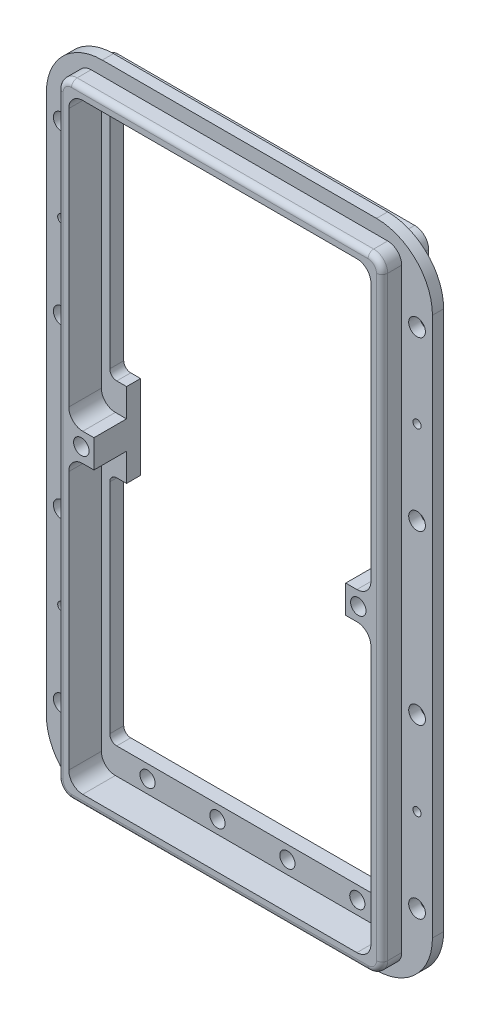
from build123d import *

# Parameters (mm, degrees)
SKETCH1_W             = 73.66
SKETCH1_H             = 141.478
PLATE_DEPTH           = 3.175
SKETCH2_W             = 73.66
SKETCH2_H             = 141.478
SKETCH2_W_2           = 68.58
SKETCH2_H_2           = 136.398
WALLS_DEPTH           = 10.576866729
LIP_W                 = 87.63
LIP_H                 = 147.828
LIP_W_2               = 73.66
LIP_H_2               = 141.478
FLANGE_DEPTH          = 2.54
FILLET1_R             = 12.7
FILLET2_R             = 3.175
FILLET3_R             = 1.27
SKETCH16_W            = 5.715
SKETCH16_H            = 6.35
EXTRUDE4_DEPTH        = 7.401866729
FILLET6_R             = 3.175
F_6_CLEARANCE_HOLE1_D = 3.7973
F_1_64_TAPPED_HOLE1_D = 1.8542
CUT_EXTRUDE7_DEPTH    = 87.573112055
FILLET7_R             = 1.5875
FILLET7_OF_MIRROR5_R  = 1.5875
MIRROR6_DEPTH         = 3.175
F_4_CLEAR_MID_D       = 3.4544
HOLE_PAT_COUNT        = 3
HOLE_PAT_PITCH        = 15.875
HOLE_PAT_COL_COUNT    = 2
HOLE_PAT_COL_PITCH    = 15.875
MIRROR7_COPY_1_D      = 3.4544
MIRROR7_COPY_2_D      = 3.4544
MIRROR7_COPY_3_D      = 3.4544
MIRROR7_COPY_4_D      = 3.4544


# Read off the part's stored shape, not the designer's step: Mirror6
with BuildPart() as part:
    # Sketch1 → plate (new body)
    with BuildSketch(Plane.XY):
        Rectangle(SKETCH1_W, SKETCH1_H)
    extrude(amount=PLATE_DEPTH)

    # Sketch2 → walls (add)
    with BuildSketch(Plane.XY):
        Rectangle(SKETCH2_W, SKETCH2_H)
        Rectangle(SKETCH2_W_2, SKETCH2_H_2, mode=Mode.SUBTRACT)
    extrude(amount=WALLS_DEPTH)

    # lip → flange (add)
    with BuildSketch(Plane(origin=(0, 0, 6.131866729), x_dir=(1, 0, 0), z_dir=(0, 0, -1))):
        Rectangle(LIP_W, LIP_H)
        Rectangle(LIP_W_2, LIP_H_2, mode=Mode.SUBTRACT)
    extrude(amount=FLANGE_DEPTH)

    # Fillet1
    fillet1_edges = [part.edges().sort_by_distance(p)[0] for p in [
        (-43.815, 73.914, 4.861866729),
        (43.815, 73.914, 4.861866729),
        (43.815, -73.914, 4.861866729),
        (-43.815, -73.914, 4.861866729),
    ]]
    fillet(fillet1_edges, radius=FILLET1_R)

    # Fillet2
    fillet2_edges = [part.edges().sort_by_distance(p)[0] for p in [
        (34.29, -68.199, 6.875933364),
        (34.29, 68.199, 6.875933364),
        (-34.29, 68.199, 6.875933364),
        (-34.29, -68.199, 6.875933364),
        (-36.83, -70.739, 1.795933365),
        (-36.83, 70.739, 1.795933365),
        (36.83, 70.739, 1.795933365),
        (36.83, -70.739, 1.795933365),
        (-36.83, -70.739, 8.354366729),
        (-36.83, 70.739, 8.354366729),
        (36.83, 70.739, 8.354366729),
        (36.83, -70.739, 8.354366729),
    ]]
    fillet(fillet2_edges, radius=FILLET2_R)

    # Fillet3
    fillet3_edges = [part.edges().sort_by_distance(p)[0] for p in [
        (0, 70.739, 10.576866729),
        (0, -70.739, 10.576866729),
        (36.83, 0, 10.576866729),
        (-35.90006403, -69.80906403, 10.576866729),
        (35.90006403, -69.80906403, 10.576866729),
        (35.90006403, 69.80906403, 10.576866729),
        (-35.90006403, 69.80906403, 10.576866729),
        (-36.83, 0, 10.576866729),
    ]]
    fillet(fillet3_edges, radius=FILLET3_R)

    # Sketch16 → Extrude4 (add)
    with BuildSketch(Plane.XY.offset(3.175)):
        with Locations((-31.4325, 0)):
            Rectangle(SKETCH16_W, SKETCH16_H)
    extrude4 = extrude(amount=EXTRUDE4_DEPTH)

    # Sketch12 → #6-32 Tapped Hole1 (revolve, cut)
    with BuildSketch(Plane(origin=(-31.4325, 0, 10.576866729), x_dir=(0, -1, 0), z_dir=(1, 0, 0))):
        Polygon((0, 0), (0, 10.20053403), (1.35255, 9.38784), (1.35255, 7.0104), (1.7526, 7.0104), (1.7526, 0), align=None)
    f_6_32_tapped_hole1 = revolve(axis=Axis((-31.4325, 0, 16.926866729), (0, 0, -1)), mode=Mode.SUBTRACT)

    # Mirror4: Extrude4, #6-32 Tapped Hole1 across plane
    add(extrude4.mirror(Plane(origin=(0, 0, 0), x_dir=(0, 0, 1), z_dir=(1, 0, 0))))
    add(f_6_32_tapped_hole1.mirror(Plane(origin=(0, 0, 0), x_dir=(0, 0, 1), z_dir=(1, 0, 0))), mode=Mode.SUBTRACT)

    # Fillet6
    fillet6_edges = [part.edges().sort_by_distance(p)[0] for p in [
        (-34.29, -3.175, 6.875933364),
        (-34.29, 3.175, 6.875933364),
        (34.29, -3.175, 6.875933364),
        (34.29, 3.175, 6.875933364),
    ]]
    fillet(fillet6_edges, radius=FILLET6_R)

    # #6 Clearance Hole1 (through all)
    with Locations(Plane(origin=(-40.3225, -57.15, 6.131866729), x_dir=(0, 1, 0), z_dir=(0, 0, 1))):
        with Locations((0, 0), (38.1, 0), (114.3, 0), (76.2, 0)):
            f_6_clearance_hole1 = Hole(F_6_CLEARANCE_HOLE1_D / 2)

    # #1-64 Tapped Hole1 (through all)
    with Locations(Plane(origin=(-40.3225, -38.1, 6.131866729), x_dir=(0, 1, 0), z_dir=(0, 0, 1))):
        with Locations((0, 0), (76.2, 0)):
            f_1_64_tapped_hole1 = Hole(F_1_64_TAPPED_HOLE1_D / 2)

    # Mirror3: #6 Clearance Hole1, #1-64 Tapped Hole1 across plane
    add(f_6_clearance_hole1.mirror(Plane(origin=(0, 0, 0), x_dir=(0, 0, 1), z_dir=(1, 0, 0))), mode=Mode.SUBTRACT)
    add(f_1_64_tapped_hole1.mirror(Plane(origin=(0, 0, 0), x_dir=(0, 0, 1), z_dir=(1, 0, 0))), mode=Mode.SUBTRACT)

    # cutout → Cut-Extrude7 (cut, through all)
    with BuildSketch(Plane.XY):
        Polygon((0, 0), (0, 62.2173), (-32.385, 62.2173), (-32.385, 9.525), (-28.575, 9.525), (-28.575, 0), align=None)
    cut_extrude7 = extrude(amount=CUT_EXTRUDE7_DEPTH, mode=Mode.SUBTRACT)

    # Fillet7
    fillet7_edges = [part.edges().sort_by_distance(p)[0] for p in [
        (-32.385, 62.2173, 1.5875),
        (-32.385, 9.525, 1.5875),
    ]]
    fillet(fillet7_edges, radius=FILLET7_R)

    # Mirror5: Cut-Extrude7 across plane
    add(cut_extrude7.mirror(Plane.ZX), mode=Mode.SUBTRACT)

    # Fillet7 of Mirror5
    fillet7_of_mirror5_edges = [part.edges().sort_by_distance(p)[0] for p in [
        (-32.385, -62.2173, 1.5875),
        (-32.385, -9.525, 1.5875),
    ]]
    fillet(fillet7_of_mirror5_edges, radius=FILLET7_OF_MIRROR5_R)

    # Mirror6 outline → Mirror6 (cut)
    with BuildSketch(Plane.XY):
        with BuildLine():
            Line((28.575, -9.525), (28.575, 9.525))
            Line((28.575, 9.525), (30.7975, 9.525))
            ThreePointArc((30.7975, 9.525), (31.920032015, 9.989967985), (32.385, 11.1125))
            Line((32.385, 11.1125), (32.385, 60.6298))
            ThreePointArc((32.385, 60.6298), (31.920032015, 61.752332015), (30.7975, 62.2173))
            Line((30.7975, 62.2173), (0, 62.2173))
            Line((0, 62.2173), (0, -62.2173))
            Line((0, -62.2173), (30.7975, -62.2173))
            ThreePointArc((30.7975, -62.2173), (31.920032015, -61.752332015), (32.385, -60.6298))
            Line((32.385, -60.6298), (32.385, -11.1125))
            ThreePointArc((32.385, -11.1125), (31.920032015, -9.989967985), (30.7975, -9.525))
            Line((30.7975, -9.525), (28.575, -9.525))
        make_face()
    extrude(amount=MIRROR6_DEPTH, mode=Mode.SUBTRACT)

    # #4 Clear Mid (through all)
    with Locations(Plane.XY.offset(3.175)):
        with Locations((-7.9375, 65.20815)):
            f_4_clear_mid = Hole(F_4_CLEAR_MID_D / 2)

    # hole pat: #4 Clear Mid ×3
    with Locations(*[(i * HOLE_PAT_PITCH, 0, 0) for i in range(1, HOLE_PAT_COUNT)]):
        add(f_4_clear_mid, mode=Mode.SUBTRACT)

    # hole pat col: #4 Clear Mid ×2
    with Locations(*[(-i * HOLE_PAT_COL_PITCH, 0, 0) for i in range(1, HOLE_PAT_COL_COUNT)]):
        add(f_4_clear_mid, mode=Mode.SUBTRACT)

    # Mirror7 copy 1 (through all)
    with Locations(Plane(origin=(15.875, 0, 3.175), x_dir=(1, 0, 0), z_dir=(0, 0, 1))):
        with Locations((-7.9375, -65.20815)):
            Hole(MIRROR7_COPY_1_D / 2)

    # Mirror7 copy 2 (through all)
    with Locations(Plane(origin=(31.75, 0, 3.175), x_dir=(1, 0, 0), z_dir=(0, 0, 1))):
        with Locations((-7.9375, -65.20815)):
            Hole(MIRROR7_COPY_2_D / 2)

    # Mirror7 copy 3 (through all)
    with Locations(Plane(origin=(-15.875, 0, 3.175), x_dir=(1, 0, 0), z_dir=(0, 0, 1))):
        with Locations((-7.9375, -65.20815)):
            Hole(MIRROR7_COPY_3_D / 2)

    # Mirror7 copy 4 (through all)
    with Locations(Plane.XY.offset(3.175)):
        with Locations((-7.9375, -65.20815)):
            Hole(MIRROR7_COPY_4_D / 2)


solid = part.part
